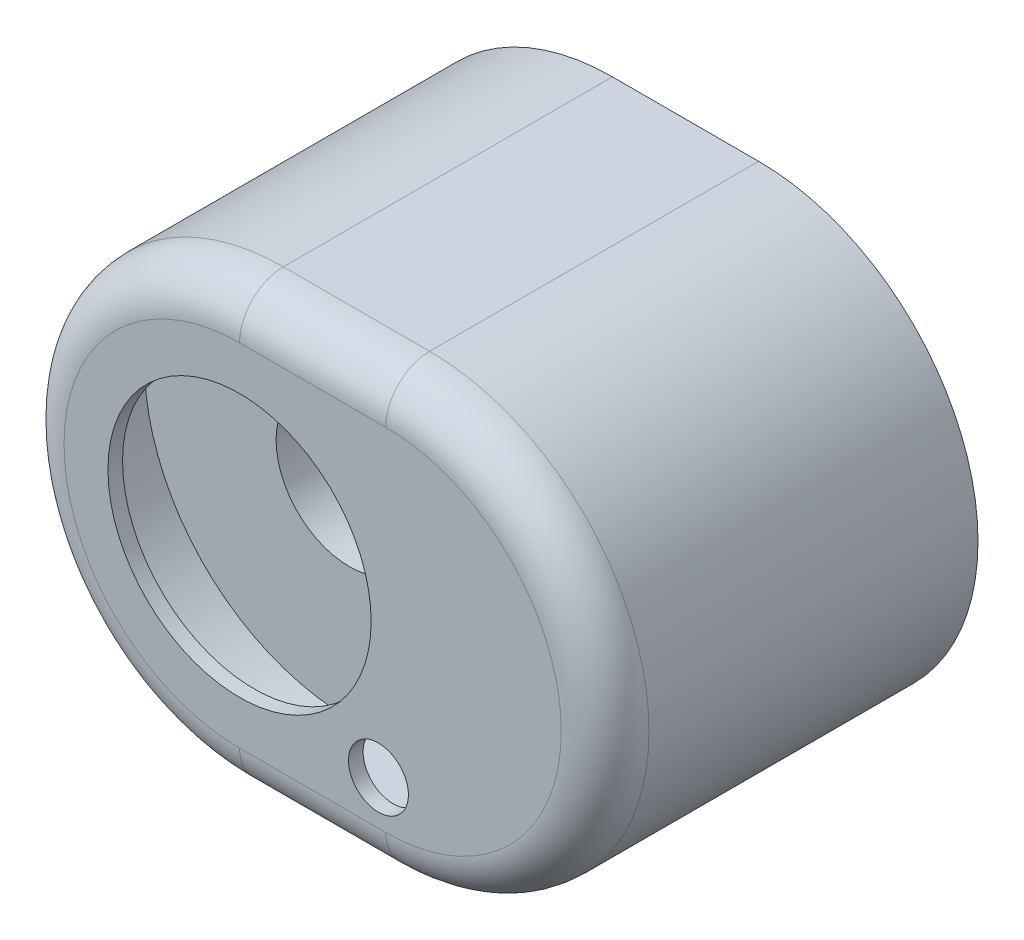
from build123d import *

# Parameters (mm, degrees)
EXTRUDE_1_DEPTH     = 51
FILLET_1_R          = 6
SHELL_1_T           = -2
SKETCH_3_R          = 18
CUT_EXTRUDE_1_DEPTH = 72.421285343
SKETCH_5_R          = 4.1
CUT_EXTRUDE_2_DEPTH = 4
EXTRUDE_START       = -2
EXTRUDE_2_DEPTH     = 6
EXTRUDE_START_2     = -3
EXTRUDE_3_DEPTH     = 3
EXTRUDE_32_REACH    = 62.465
EXTRUDE_36_REACH    = 62.465
EXTRUDE_37_REACH    = 62.465
SKETCH_14_W         = 19.811684382
SKETCH_14_H         = 2
EXTRUDE_4_DEPTH     = 24.8
HOLE_WIZARD_1_D     = 2
HOLE_WIZARD_1_DEPTH = 20


# Read off the part's stored shape, not the designer's step: 凸台-拉伸4
with BuildPart() as part:
    # 草图2 → 凸台-拉伸1 (new body)
    with BuildSketch(Plane.XY):
        with BuildLine():
            Line((-10, 30), (10, 30))
            ThreePointArc((10, 30), (40, 0), (10, -30))
            Line((10, -30), (-10, -30))
            ThreePointArc((-10, -30), (-40, 0), (-10, 30))
        make_face()
    extrude(amount=EXTRUDE_1_DEPTH)

    # 圆角1
    fillet_1_edges = [part.edges().sort_by_distance(p)[0] for p in [
        (40, 0, 51),
        (0, 30, 51),
        (-40, 0, 51),
        (0, -30, 51),
    ]]
    fillet(fillet_1_edges, radius=FILLET_1_R)

    # 抽壳1
    shell_1_openings = [part.faces().sort_by_distance(p)[0] for p in [
        (0, 0, 0),
    ]]
    offset(amount=SHELL_1_T, openings=shell_1_openings, kind=Kind.INTERSECTION)

    # 草图3 → 切除-拉伸1 (cut, through all)
    with BuildSketch(Plane.XY.offset(51)):
        with Locations((-10, 0)):
            Circle(SKETCH_3_R)
    extrude(amount=-CUT_EXTRUDE_1_DEPTH, mode=Mode.SUBTRACT)

    # 草图5 → 切除-拉伸2 (cut)
    with BuildSketch(Plane.XY.offset(51)):
        with Locations((9, -18)):
            Circle(SKETCH_5_R)
    extrude(amount=-CUT_EXTRUDE_2_DEPTH, mode=Mode.SUBTRACT)

    # 草图6 → 凸台-拉伸2 (add)
    with BuildSketch(Plane(origin=(0, 0, 0), x_dir=(-1, 0, 0), z_dir=(0, 0, -1)).offset(EXTRUDE_START)):
        with BuildLine():
            Line((10, 28), (-10, 28))
            ThreePointArc((-10, 28), (-38, 0), (-10, -28))
            Line((-10, -28), (10, -28))
            ThreePointArc((10, -28), (38, 0), (10, 28))
        make_face()
        with BuildLine():
            Line((10, 26.5), (-10, 26.5))
            ThreePointArc((-10, 26.5), (-36.5, 0), (-10, -26.5))
            Line((-10, -26.5), (10, -26.5))
            ThreePointArc((10, -26.5), (36.5, 0), (10, 26.5))
        make_face(mode=Mode.SUBTRACT)
    extrude(amount=-EXTRUDE_2_DEPTH)



with BuildPart() as body_2:
    # 草图4 → 旋转1 (revolve)
    with BuildSketch(Plane(origin=(0, 0, 0), x_dir=(1, 0, 0), z_dir=(0, 1, 0))):
        Polygon((-20, -36), (-20, -30), (-18, -30), (-18, -28), (-14.5, -23), (-14.5, -21), (-16.5, -21), (-16.5, -17), (-19.5, -17), (-19.5, -23.167682505), (-23, -28.167682505), (-23, -36), align=None)
    revolve(axis=Axis((-10, 0, 0), (0, 0, 1)))


with BuildPart() as part_1:
    add(part.part)

    add(body_2.part)  # 凸台-拉伸3 merges body 2
    # 草图7 → 凸台-拉伸3 (add)
    with BuildSketch(Plane.XY.offset(36).offset(EXTRUDE_START_2)):
        with BuildLine():
            Line((-3, 7.141428429), (-3, 28))
            Line((-3, 28), (-10, 28))
            ThreePointArc((-10, 28), (-38, 0), (-10, -28))
            Line((-10, -28), (-3, -28))
            Line((-3, -28), (-3, -7.141428429))
            ThreePointArc((-3, -7.141428429), (-20, 0), (-3, 7.141428429))
        make_face()
    extrude(amount=EXTRUDE_3_DEPTH)

    # 草图12 → 拉伸-薄壁32 (add, up to next)
    with BuildSketch(Plane(origin=(0, 0, 17), x_dir=(-1, 0, 0), z_dir=(0, 0, -1)), mode=Mode.PRIVATE) as extrude_32_sk1:
        Polygon((3, -28), (3, -10.95445115), (6.5, -5.477225575), (8.185300177, -6.554148652), (5, -11.538893679), (5, -28), align=None)
    extrude_32_tool1 = extrude(extrude_32_sk1.sketch, amount=-EXTRUDE_32_REACH, mode=Mode.PRIVATE) - part_1.part
    add(extrude_32_tool1.solids().sort_by_distance((-4.44371, -16.649108, 17))[0])

    # 草图12<6> → 拉伸-薄壁36 (add, up to next)
    with BuildSketch(Plane(origin=(0, 0, 17), x_dir=(-1, 0, 0), z_dir=(0, 0, -1)), mode=Mode.PRIVATE) as extrude_36_sk1:
        Polygon((3, 26.5), (3, 10.95445115), (6.5, 5.477225575), (8.185300177, 6.554148652), (5, 11.538893679), (5, 26.5), align=None)
    extrude_36_tool1 = extrude(extrude_36_sk1.sketch, amount=-EXTRUDE_36_REACH, mode=Mode.PRIVATE) - part_1.part
    add(extrude_36_tool1.solids().sort_by_distance((-4.474722, 15.908171, 17))[0])

    # 草图14 → 拉伸-薄壁37 (add, up to next)
    with BuildSketch(Plane(origin=(0, 0, 17), x_dir=(-1, 0, 0), z_dir=(0, 0, -1)), mode=Mode.PRIVATE) as extrude_37_sk1:
        with Locations((28.094157809, 0)):
            Rectangle(SKETCH_14_W, SKETCH_14_H)
    extrude_37_tool1 = extrude(extrude_37_sk1.sketch, amount=-EXTRUDE_37_REACH, mode=Mode.PRIVATE) - part_1.part
    # 草图14 → 拉伸-薄壁37 (add, up to next)
    with BuildSketch(Plane(origin=(0, 0, 17), x_dir=(-1, 0, 0), z_dir=(0, 0, -1)), mode=Mode.PRIVATE) as extrude_37_sk2:
        Polygon((16.029392267, 5.629826068), (28.764097514, 20.806456798), (27.232008628, 22.092032017), (14.49730338, 6.915401287), align=None)
    extrude_37_tool2 = extrude(extrude_37_sk2.sketch, amount=-EXTRUDE_37_REACH, mode=Mode.PRIVATE) - part_1.part
    # 草图14 → 拉伸-薄壁37 (add, up to next)
    with BuildSketch(Plane(origin=(0, 0, 17), x_dir=(-1, 0, 0), z_dir=(0, 0, -1)), mode=Mode.PRIVATE) as extrude_37_sk3:
        Polygon((14.49730338, -6.915401287), (27.232008628, -22.092032017), (28.764097514, -20.806456798), (16.029392267, -5.629826068), align=None)
    extrude_37_tool3 = extrude(extrude_37_sk3.sketch, amount=-EXTRUDE_37_REACH, mode=Mode.PRIVATE) - part_1.part
    add(extrude_37_tool1.solids().sort_by_distance((-28.094158, 0, 17))[0])
    add(extrude_37_tool2.solids().sort_by_distance((-21.6307, 13.860929, 17))[0])
    add(extrude_37_tool3.solids().sort_by_distance((-21.6307, -13.860929, 17))[0])

    # 凸台-拉伸4 outline → 凸台-拉伸4 (add)
    with BuildSketch(Plane.XY.offset(24.2)):
        with BuildLine():
            ThreePointArc((16.890769815, -27.138852064), (21.143513187, -25.687002819), (25.109230185, -23.573526745))
            Line((25.109230185, -23.573526745), (25.109230185, -19.500000001))
            ThreePointArc((25.109230185, -19.500000001), (21.000000001, -15.390769815), (16.890769815, -19.5))
            Line((16.890769815, -19.5), (16.890769815, -27.138852064))
        make_face()
        with BuildLine():
            ThreePointArc((16.890769815, 19.5), (21.000000001, 15.390769815), (25.109230185, 19.500000001))
            Line((25.109230185, 19.500000001), (25.109230185, 23.573526745))
            ThreePointArc((25.109230185, 23.573526745), (21.143513187, 25.687002819), (16.890769815, 27.138852064))
            Line((16.890769815, 27.138852064), (16.890769815, 19.5))
        make_face()
    extrude(amount=EXTRUDE_4_DEPTH)

    # 孔1
    with Locations(Plane(origin=(0, 0, 24.2), x_dir=(-1, 0, 0), z_dir=(0, 0, -1))):
        with Locations((-21, 19.5), (-21, -19.5)):
            Hole(HOLE_WIZARD_1_D / 2, depth=HOLE_WIZARD_1_DEPTH)


solid = part_1.part
